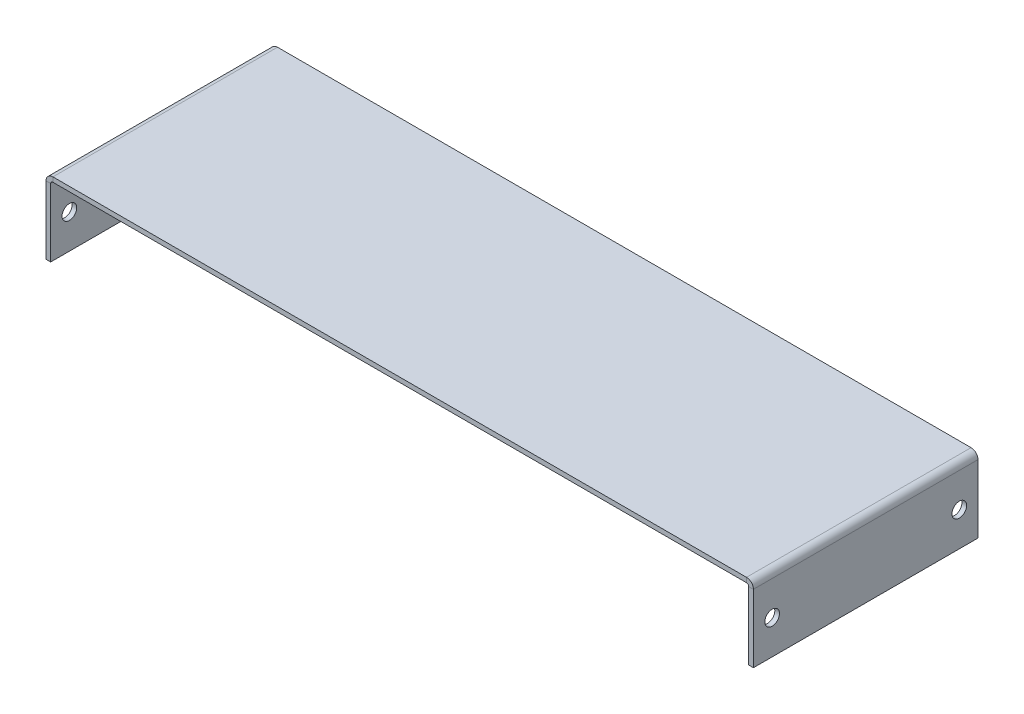
from build123d import *

# Parameters (mm, degrees)
BASE_FLANGE1_DEPTH = 38.1
SKETCH6_R          = 2.4892
CUT_EXTRUDE1_DEPTH = 245.358693113


# Sheet-metal steps are written as plain solids
with BuildPart() as part:
    # Sketch1 → Base-Flange1 (new, symmetric)
    with BuildSketch(Plane.XY):
        with BuildLine():
            Line((-120.015, 0), (-120.015, 23.0505))
            ThreePointArc((-120.015, 23.0505), (-119.326847382, 24.711847382), (-117.6655, 25.4))
            Line((-117.6655, 25.4), (117.6655, 25.4))
            ThreePointArc((117.6655, 25.4), (119.326847382, 24.711847382), (120.015, 23.0505))
            Line((120.015, 23.0505), (120.015, 0))
            Line((120.015, 0), (118.4275, 0))
            Line((118.4275, 0), (118.4275, 23.0505))
            ThreePointArc((118.4275, 23.0505), (118.204315367, 23.589315367), (117.6655, 23.8125))
            Line((117.6655, 23.8125), (-117.6655, 23.8125))
            ThreePointArc((-117.6655, 23.8125), (-118.204315367, 23.589315367), (-118.4275, 23.0505))
            Line((-118.4275, 23.0505), (-118.4275, 0))
            Line((-118.4275, 0), (-120.015, 0))
        make_face()
    extrude(amount=BASE_FLANGE1_DEPTH, both=True)

    # Sketch6 → Cut-Extrude1 (cut, through all)
    with BuildSketch(Plane.ZY.offset(120.015)):
        with Locations((-31.75, 11.52525)):
            Circle(SKETCH6_R)
        with Locations((31.75, 11.52525)):
            Circle(SKETCH6_R)
    extrude(amount=-CUT_EXTRUDE1_DEPTH, mode=Mode.SUBTRACT)


solid = part.part
